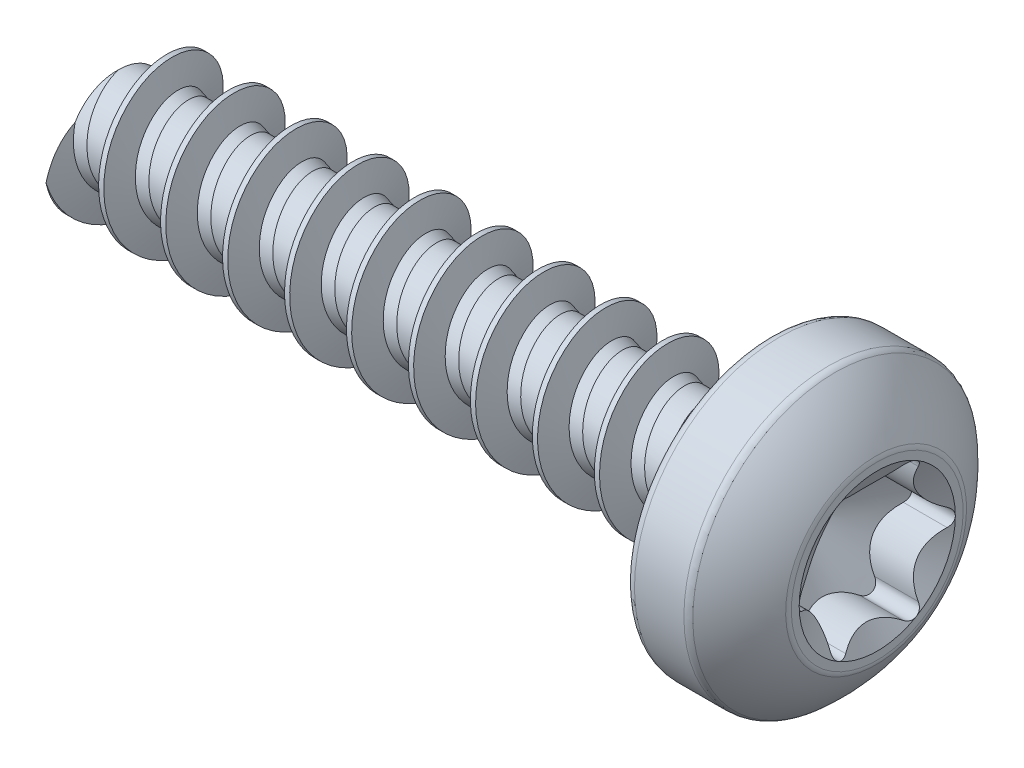
from build123d import *

# Parameters (mm, degrees)
BOSS_EXTRUDE1_REACH = 13.498
SKETCH3_R           = 1.2573
SKETCH9_W           = 8.617857143
SKETCH9_H           = 1.0922
CUT_SWEEP1_PITCH    = 0.907142857


# Read off the part's stored shape, not the designer's step: Split1
with BuildPart() as part:
    # Sketch2 → Revolve1 (revolve)
    with BuildSketch(Plane.XY):
        with BuildLine():
            Line((-5.5499, 0), (5.5499, 0))
            Line((5.5499, 0), (5.5499, 1.2573))
            ThreePointArc((5.5499, 1.2573), (5.545615628, 1.291884813), (5.533021535, 1.32437872))
            ThreePointArc((5.533021535, 1.32437872), (5.266919222, 1.73063203), (4.934585046, 2.084759391))
            ThreePointArc((4.934585046, 2.084759391), (4.890649551, 2.111556895), (4.84004184, 2.1209))
            Line((4.84004184, 2.1209), (4.116832, 2.1209))
            ThreePointArc((4.116832, 2.1209), (4.016612342, 2.079387658), (3.9751, 1.979168))
            Line((3.9751, 1.979168), (3.9751, 1.002979476))
            ThreePointArc((3.9751, 1.002979476), (3.892075317, 0.80254016), (3.691636, 0.719515476))
            Line((3.691636, 0.719515476), (3.209019778, 0.719515476))
            Line((3.209019778, 0.719515476), (3.067957143, 0.681717857))
            Line((3.067957143, 0.681717857), (-5.5499, 0.681717857))
            Line((-5.5499, 0.681717857), (-5.5499, 0))
        make_face()
    revolve(axis=Axis((-5.5499, 0, 0), (-1, 0, 0)))

    # Sketch12 → Cut-Revolve3 (revolve, cut)
    with BuildSketch(Plane.XY, mode=Mode.PRIVATE) as cut_revolve3_sk:
        Polygon((5.5499, 1.143), (4.9101375, 1.143), (4.250226142, 0), (5.5499, 0), align=None)
    revolve(cut_revolve3_sk.sketch.rotate(Axis((-5.5499, 0, 0), (1, 0, 0)), 90), axis=Axis((-5.5499, 0, 0), (1, 0, 0)), mode=Mode.SUBTRACT)

    # Boss-Extrude1: up to this cone (the profile starts inside it)
    boss_extrude1_end = Plane(origin=(5.5499, 0, 0), z_dir=(1, 0, 0)).offset(-1.299672858) * Cone(1.732e-06, 30.395369932, 17.548774012, align=(Align.CENTER, Align.CENTER, Align.MIN), mode=Mode.PRIVATE)
    # Sketch3 → Boss-Extrude1 (add, up to the surface)
    with BuildSketch(Plane(origin=(5.5499, 0, 0), x_dir=(0, 0, -1), z_dir=(1, 0, 0)), mode=Mode.PRIVATE) as boss_extrude1_sk1:
        Circle(SKETCH3_R)
        with BuildLine():
            ThreePointArc((-0.420656536, 0.984910584), (1.5e-08, 0.85725), (0.420656561, 0.984910601))
            ThreePointArc((0.420656561, 0.984910601), (0.495370425, 1.008931591), (0.5715, 0.989867037))
            ThreePointArc((0.5715, 0.989867037), (0.626075183, 0.933469155), (0.642629319, 0.856754538))
            ThreePointArc((0.642629319, 0.856754538), (0.742400285, 0.428624987), (1.063285882, 0.128156032))
            ThreePointArc((1.063285882, 0.128156032), (1.121445601, 0.075462423), (1.143, 0))
            ThreePointArc((1.143, 0), (1.121445593, -0.075462436), (1.063285854, -0.128156046))
            ThreePointArc((1.063285854, -0.128156046), (0.74240027, -0.428625013), (0.642629321, -0.856754569))
            ThreePointArc((0.642629321, -0.856754569), (0.626075176, -0.933469168), (0.5715, -0.989867037))
            ThreePointArc((0.5715, -0.989867037), (0.49537041, -1.008931591), (0.420656536, -0.984910584))
            ThreePointArc((0.420656536, -0.984910584), (-1.5e-08, -0.85725), (-0.420656561, -0.984910601))
            ThreePointArc((-0.420656561, -0.984910601), (-0.495370425, -1.008931591), (-0.5715, -0.989867037))
            ThreePointArc((-0.5715, -0.989867037), (-0.626075183, -0.933469155), (-0.642629319, -0.856754538))
            ThreePointArc((-0.642629319, -0.856754538), (-0.742400285, -0.428624987), (-1.063285882, -0.128156032))
            ThreePointArc((-1.063285882, -0.128156032), (-1.121445601, -0.075462423), (-1.143, 0))
            ThreePointArc((-1.143, 0), (-1.121445593, 0.075462436), (-1.063285854, 0.128156046))
            ThreePointArc((-1.063285854, 0.128156046), (-0.74240027, 0.428625013), (-0.642629321, 0.856754569))
            ThreePointArc((-0.642629321, 0.856754569), (-0.626075176, 0.933469168), (-0.5715, 0.989867037))
            ThreePointArc((-0.5715, 0.989867037), (-0.49537041, 1.008931591), (-0.420656536, 0.984910584))
        make_face(mode=Mode.SUBTRACT)
    boss_extrude1_tool1 = extrude(boss_extrude1_sk1.sketch, amount=-BOSS_EXTRUDE1_REACH, mode=Mode.PRIVATE) & boss_extrude1_end
    add(boss_extrude1_tool1.solids().sort_by_distance((5.5499, 0, 1.221738))[0])

    # Cut-Extrude2 cone 1 section (through the dimple's axis) → Cut-Extrude2 (revolve, cut)
    with BuildSketch(Plane(origin=(5.5499, 0, 0), x_dir=(0, 0, -1), z_dir=(0, 1, 0))):
        Polygon((0, 0), (1.143, 0), (0, 0.659911358), align=None)
    revolve(axis=Axis((5.5499, 0, 0), (-1, 0, 0)), mode=Mode.SUBTRACT)

    # Split1 outline → Split1 (revolve, cut)
    with BuildSketch(Plane.YX):
        Polygon((0.681717857, -5.5499), (0.681717857, 3.067957143), (0, 0.523751464), (0, -5.5499), align=None)
    revolve(axis=Axis((0, 0, 0), (1, 0, 0)), mode=Mode.SUBTRACT)


with BuildPart() as body_2:
    # Split1 2 outline → Split1 2 (revolve)
    with BuildSketch(Plane.YX):
        Polygon((0.681717857, -5.5499), (0.681717857, 3.067957143), (0, 0.523751464), (0, -5.5499), align=None)
    revolve(axis=Axis((0, 0, 0), (1, 0, 0)))

    # Sketch9 → Revolve2 (revolve)
    with BuildSketch(Plane.XY):
        with Locations((-1.240971428, 0.5461)):
            Rectangle(SKETCH9_W, SKETCH9_H)
    revolve(axis=Axis((-5.5499, 0, 0), (1, 0, 0)))

    # Cut-Sweep1: the profile of Sketch7 screwed along a right-hand helix of 11.5 turns, 8 arcs to a turn; built about Z, then put on its axis
    cut_sweep1_z = Axis((0, 0, 0), (0, 0, 1))
    cut_sweep1_corners = [(1.0922, 0, -0.331486023), (0.72383626, 0, -0.43018879), (0.681717857, 0, -0.587376808), (0.681717857, 0, -0.907142857), (0.72383626, 0, -1.064330876), (1.0922, 0, -1.163033642), (1.190401095, 0, -1.163033642), (1.190401095, 0, -0.331486023)]
    with BuildLine(mode=Mode.PRIVATE) as cut_sweep1_profile:
        Line(cut_sweep1_corners[0], cut_sweep1_corners[1])
        Line(cut_sweep1_corners[1], cut_sweep1_corners[2])
        Line(cut_sweep1_corners[2], cut_sweep1_corners[3])
        Line(cut_sweep1_corners[3], cut_sweep1_corners[4])
        Line(cut_sweep1_corners[4], cut_sweep1_corners[5])
        Line(cut_sweep1_corners[5], cut_sweep1_corners[6])
        Line(cut_sweep1_corners[6], cut_sweep1_corners[7])
        Line(cut_sweep1_corners[7], cut_sweep1_corners[0])
    cut_sweep1_cap = Face(cut_sweep1_profile.wire())
    cut_sweep1_turn_angles = [0, 22.5, 45, 67.5, 90, 112.5, 135, 157.5, 180, 202.5, 225, 247.5, 270, 292.5, 315, 337.5, 360]
    cut_sweep1_turn_weights = [1, 0.9238795325112867, 1, 0.9238795325112867, 1, 0.9238795325112867, 1, 0.9238795325112867, 1, 0.9238795325112867, 1, 0.9238795325112867, 1, 0.9238795325112867, 1, 0.9238795325112867, 1]
    cut_sweep1_turn_rails = [Edge.make_bspline([Vector(p[0], p[1], 0).rotate(cut_sweep1_z, cut_sweep1_turn_angles[k]) / cut_sweep1_turn_weights[k] + Vector(0, 0, p[2] + CUT_SWEEP1_PITCH * cut_sweep1_turn_angles[k] / 360) for k in range(17)], [0, 0, 0, 1, 1, 2, 2, 3, 3, 4, 4, 5, 5, 6, 6, 7, 7, 8, 8, 8], 2, cut_sweep1_turn_weights) for p in cut_sweep1_corners]
    cut_sweep1_turn_sides = [Face.make_surface_from_curves(cut_sweep1_turn_rails[p[0]], cut_sweep1_turn_rails[p[1]]) for p in [(0, 1), (1, 2), (2, 3), (3, 4), (4, 5), (5, 6), (6, 7), (7, 0)]]
    cut_sweep1_last_angles = [3960, 3982.5, 4005, 4027.5, 4050, 4072.5, 4095, 4117.5, 4140]
    cut_sweep1_last_weights = [1, 0.9238795325112867, 1, 0.9238795325112867, 1, 0.9238795325112867, 1, 0.923879532511387, 1]
    cut_sweep1_last_rails = [Edge.make_bspline([Vector(p[0], p[1], 0).rotate(cut_sweep1_z, cut_sweep1_last_angles[k]) / cut_sweep1_last_weights[k] + Vector(0, 0, p[2] + CUT_SWEEP1_PITCH * cut_sweep1_last_angles[k] / 360) for k in range(9)], [0, 0, 0, 1, 1, 2, 2, 3, 3, 4, 4, 4], 2, cut_sweep1_last_weights) for p in cut_sweep1_corners]
    cut_sweep1_last_sides = [Face.make_surface_from_curves(cut_sweep1_last_rails[p[0]], cut_sweep1_last_rails[p[1]]) for p in [(0, 1), (1, 2), (2, 3), (3, 4), (4, 5), (5, 6), (6, 7), (7, 0)]]
    cut_sweep1 = Plane(origin=(-5.5499, 0, 0), x_dir=(0, 1, 0), z_dir=(1, 0, 0)) * Solid(Shell([*[p.moved(Location((0, 0, CUT_SWEEP1_PITCH * i))) for i in range(11) for p in cut_sweep1_turn_sides], *cut_sweep1_last_sides, cut_sweep1_cap, cut_sweep1_cap.rotate(cut_sweep1_z, 4140).moved(Location((0, 0, CUT_SWEEP1_PITCH * 4140 / 360)))]))
    add(cut_sweep1, mode=Mode.SUBTRACT)

    # Sketch11 → Cut-Revolve2 (revolve, cut)
    with BuildSketch(Plane.XY):
        Polygon((3.067957143, 0.681717857), (2.957968784, 1.0922), (3.067957143, 1.0922), align=None)
    revolve(axis=Axis((-5.5499, 0, 0), (1, 0, 0)), mode=Mode.SUBTRACT)

    # Combine1: union part
    add(part.part)


solid = body_2.part
